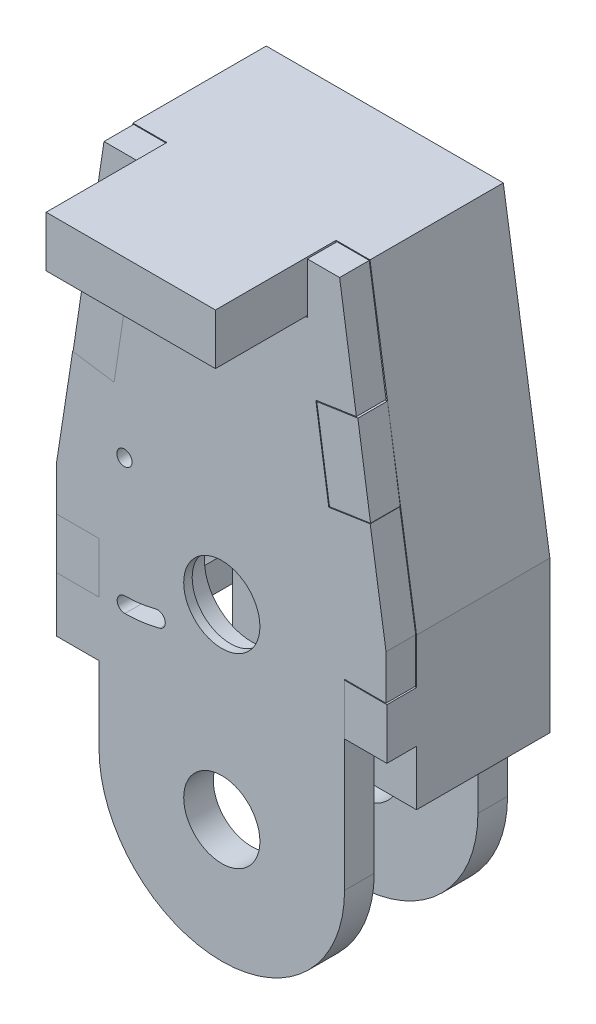
from build123d import *

# Parameters (mm, degrees)
SKETCH1_R           = 4
BOSS_EXTRUDE1_DEPTH = 30
SKETCH1_3_R         = 4
CUT_EXTRUDE1_DEPTH  = 17.5
BOSS_EXTRUDE2_DEPTH = 7
BOSS_EXTRUDE3_DEPTH = 31.5
CUT_EXTRUDE2_DEPTH  = 224.888365039
SKETCH5_R           = 9
CUT_EXTRUDE3_DEPTH  = 224.888365039
SKETCH5_3_R         = 11.1
SKETCH5_3_R_2       = 9
CUT_EXTRUDE4_DEPTH  = 5
SKETCH8_W           = 10
SKETCH8_H           = 12
BOSS_EXTRUDE4_DEPTH = 7
BOSS_EXTRUDE6_DEPTH = 7
SKETCH12_R          = 9
CUT_EXTRUDE5_DEPTH  = 220.79365323
CUT_EXTRUDE8_START  = -5
SKETCH12_6_R        = 11.1
SKETCH12_6_R_2      = 9
CUT_EXTRUDE8_DEPTH  = 5
SKETCH14_R          = 1.8
CUT_EXTRUDE9_DEPTH  = 7
CUT_EXTRUDE10_DEPTH = 24.5
SKETCH16_W          = 80
SKETCH16_H          = 75
CUT_EXTRUDE11_DEPTH = 162.669415784


# Read off the part's stored shape, not the designer's step: Boss-Extrude6
with BuildPart() as part:
    # Sketch1 → Boss-Extrude1 (new, symmetric)
    with BuildSketch(Plane.XY):
        with BuildLine():
            Line((-20, -72), (20, -72))
            Line((20, -72), (20, 0))
            ThreePointArc((20, 0), (18.973665961, 6.32455532), (16, 12))
            ThreePointArc((16, 12), (0, 16.622844919), (-16, 12))
            ThreePointArc((-16, 12), (-18.973665961, 6.32455532), (-20, 0))
            Line((-20, 0), (-20, -72))
        make_face()
        Circle(SKETCH1_R, mode=Mode.SUBTRACT)
    extrude(amount=BOSS_EXTRUDE1_DEPTH, both=True)

    # Sketch1<3> → Cut-Extrude1 (cut, symmetric)
    with BuildSketch(Plane.XY):
        with BuildLine():
            Line((-20, -60), (20, -60))
            Line((20, -60), (20, 0))
            ThreePointArc((20, 0), (18.973665961, 6.32455532), (16, 12))
            ThreePointArc((16, 12), (0, 16.622844919), (-16, 12))
            ThreePointArc((-16, 12), (-18.973665961, 6.32455532), (-20, 0))
            Line((-20, 0), (-20, -60))
        make_face()
        Circle(SKETCH1_3_R, mode=Mode.SUBTRACT)
    extrude(amount=CUT_EXTRUDE1_DEPTH, both=True, mode=Mode.SUBTRACT)

    # Sketch2 → Boss-Extrude2 (add)
    with BuildSketch(Plane(origin=(0, 0, -30), x_dir=(-1, 0, 0), z_dir=(0, 0, -1))):
        with BuildLine():
            Line((-20, -72), (-29, -132))
            Line((-29, -132), (-29, -167))
            Line((-29, -167), (-29, -185))
            ThreePointArc((-29, -185), (0, -214), (29, -185))
            Line((29, -185), (29, -167))
            Line((29, -167), (29, -132))
            Line((29, -132), (20, -72))
            Line((20, -72), (-20, -72))
        make_face()
    extrude(amount=-BOSS_EXTRUDE2_DEPTH)

    # Sketch2<3> → Boss-Extrude3 (add)
    with BuildSketch(Plane(origin=(0, 0, -30), x_dir=(-1, 0, 0), z_dir=(0, 0, -1))):
        Polygon((-29, -167), (-29, -132), (-20, -72), (-20, -60), (-28, -60), (-39, -131.254171946), (-39, -167), align=None)
        Polygon((20, -60), (20, -72), (29, -132), (29, -167), (39, -167), (39, -131.254171946), (28, -60), align=None)
    extrude(amount=-BOSS_EXTRUDE3_DEPTH)

    # Sketch4 → Cut-Extrude2 (cut, through all)
    with BuildSketch(Plane.XY.offset(-23)):
        with BuildLine():
            Line((-13.7, -112), (-13.7, -105))
            ThreePointArc((-13.7, -105), (-15.5, -103.2), (-17.3, -105))
            Line((-17.3, -105), (-17.3, -112))
            ThreePointArc((-17.3, -112), (-15.5, -113.8), (-13.7, -112))
        make_face()
        with BuildLine():
            Line((17.3, -112), (17.3, -105))
            ThreePointArc((17.3, -105), (15.5, -103.2), (13.7, -105))
            Line((13.7, -105), (13.7, -112))
            ThreePointArc((13.7, -112), (15.5, -113.8), (17.3, -112))
        make_face()
        with BuildLine():
            Line((17.3, -81), (17.3, -74))
            ThreePointArc((17.3, -74), (15.5, -72.2), (13.7, -74))
            Line((13.7, -74), (13.7, -81))
            ThreePointArc((13.7, -81), (15.5, -82.8), (17.3, -81))
        make_face()
        with BuildLine():
            Line((11.1, -96.5), (11.1, -89.5))
            ThreePointArc((11.1, -89.5), (0, -78.4), (-11.1, -89.5))
            Line((-11.1, -89.5), (-11.1, -96.5))
            ThreePointArc((-11.1, -96.5), (0, -107.6), (11.1, -96.5))
        make_face()
        with BuildLine():
            Line((-13.7, -81), (-13.7, -74))
            ThreePointArc((-13.7, -74), (-15.5, -72.2), (-17.3, -74))
            Line((-17.3, -74), (-17.3, -81))
            ThreePointArc((-17.3, -81), (-15.5, -82.8), (-13.7, -81))
        make_face()
    extrude(amount=-CUT_EXTRUDE2_DEPTH, mode=Mode.SUBTRACT)

    # Sketch5 → Cut-Extrude3 (cut, through all)
    with BuildSketch(Plane.XY.offset(-23)):
        with Locations((0, -185)):
            Circle(SKETCH5_R)
        with Locations((0, -141)):
            Circle(SKETCH5_R)
    extrude(amount=-CUT_EXTRUDE3_DEPTH, mode=Mode.SUBTRACT)

    # Sketch5<3> → Cut-Extrude4 (cut)
    # profile 1 of 2: a face of its own
    with BuildSketch(Plane.XY.offset(-23)):
        with Locations((0, -141)):
            Circle(SKETCH5_3_R)
        with Locations((0, -141)):
            Circle(SKETCH5_3_R_2, mode=Mode.SUBTRACT)
    # profile 2 of 2: a face of its own
    with BuildSketch(Plane.XY.offset(-23)):
        with Locations((0, -185)):
            Circle(SKETCH5_3_R)
        with Locations((0, -185)):
            Circle(SKETCH5_3_R_2, mode=Mode.SUBTRACT)
    extrude(amount=-CUT_EXTRUDE4_DEPTH, mode=Mode.SUBTRACT)

    # Sketch8 → Boss-Extrude4 (add)
    with BuildSketch(Plane.XY.offset(1.5)):
        Polygon((-22.43982913, -88.265527531), (-32.138947235, -86.810659815), (-35.138947235, -106.810659815), (-25.43982913, -108.265527531), align=None)
        with Locations((-34, -148)):
            Rectangle(SKETCH8_W, SKETCH8_H)
        with Locations((34, -148)):
            Rectangle(SKETCH8_W, SKETCH8_H)
        Polygon((25.43982913, -108.265527531), (22.43982913, -88.265527531), (32.138947235, -86.810659815), (35.138947235, -106.810659815), align=None)
    extrude(amount=BOSS_EXTRUDE4_DEPTH)

    # Sketch15 → Cut-Extrude10 (cut)
    with BuildSketch(Plane.XY.offset(-23)):
        with BuildLine():
            Line((-29, -145), (-29, -160))
            ThreePointArc((-29, -160), (-31.95326153, -152.5), (-29, -145))
        make_face()
    extrude(amount=CUT_EXTRUDE10_DEPTH, mode=Mode.SUBTRACT)

    # Sketch16 → Cut-Extrude11 (cut, through all)
    with BuildSketch(Plane(origin=(0, -60, 0), x_dir=(1, 0, 0), z_dir=(0, 1, 0))):
        Rectangle(SKETCH16_W, SKETCH16_H)
    extrude(amount=CUT_EXTRUDE11_DEPTH, mode=Mode.SUBTRACT)


with BuildPart() as body_2:
    # Boss-Extrude6 outline → Boss-Extrude6 (new body)
    with BuildSketch(Plane.XY.offset(1.5)):
        with BuildLine():
            ThreePointArc((-29, -185), (0, -214), (29, -185))
            Line((29, -185), (29, -141.8))
            Line((29, -141.8), (38.8, -141.8))
            Line((38.8, -141.8), (38.8, -131.26951874))
            Line((38.8, -131.26951874), (35.050902338, -106.984168789))
            Line((35.050902338, -106.984168789), (25.271837137, -108.493830809))
            Line((25.271837137, -108.493830809), (22.212373769, -88.097408351))
            Line((22.212373769, -88.097408351), (31.796725847, -86.659755539))
            Line((31.796725847, -86.659755539), (27.827762516, -60.2))
            Line((27.827762516, -60.2), (20.2, -60.2))
            Line((20.2, -60.2), (20.2, -72.2))
            Line((20.2, -72.2), (-20.2, -72.2))
            Line((-20.2, -72.2), (-20.2, -60.2))
            Line((-20.2, -60.2), (-27.827762516, -60.2))
            Line((-27.827762516, -60.2), (-31.796725847, -86.659755539))
            Line((-31.796725847, -86.659755539), (-22.410161039, -88.067740261))
            Line((-22.410161039, -88.067740261), (-25.43982913, -108.265527531))
            Line((-25.43982913, -108.265527531), (-35.218046965, -106.755996324))
            Line((-35.218046965, -106.755996324), (-39, -131.254171946))
            Line((-39, -131.254171946), (-39, -142))
            Line((-39, -142), (-29, -142))
            Line((-29, -142), (-29, -154))
            Line((-29, -154), (-39, -154))
            Line((-39, -154), (-39, -167))
            Line((-39, -167), (-29, -167))
            Line((-29, -167), (-29, -185))
        make_face()
    extrude(amount=BOSS_EXTRUDE6_DEPTH)

    # Sketch12 → Cut-Extrude5 (cut, through all)
    with BuildSketch(Plane(origin=(0, 0, 1.5), x_dir=(-1, 0, 0), z_dir=(0, 0, -1))):
        with Locations((0, -185)):
            Circle(SKETCH12_R)
        with Locations((0, -141)):
            Circle(SKETCH12_R)
    extrude(amount=-CUT_EXTRUDE5_DEPTH, mode=Mode.SUBTRACT)

    # Sketch12<6> → Cut-Extrude8 (cut)
    with BuildSketch(Plane(origin=(0, 0, 1.5), x_dir=(-1, 0, 0), z_dir=(0, 0, -1)).offset(CUT_EXTRUDE8_START)):
        with Locations((0, -141)):
            Circle(SKETCH12_6_R)
        with Locations((0, -141)):
            Circle(SKETCH12_6_R_2, mode=Mode.SUBTRACT)
    extrude(amount=CUT_EXTRUDE8_DEPTH, mode=Mode.SUBTRACT)

    # Sketch14 → Cut-Extrude9 (cut)
    with BuildSketch(Plane.XY.offset(8.5)):
        with BuildLine():
            ThreePointArc((-22.909945843, -154.299872488), (-18.76, -154.016065744), (-14.682601732, -153.193010378))
            ThreePointArc((-14.682601732, -153.193010378), (-13.416057651, -150.984874039), (-15.624193989, -149.718329958))
            ThreePointArc((-15.624193989, -149.718329958), (-19.24, -150.448209245), (-22.920140653, -150.699886923))
            ThreePointArc((-22.920140653, -150.699886923), (-24.715036031, -152.504977111), (-22.909945843, -154.299872488))
        make_face()
        with Locations((-23, -122.5)):
            Circle(SKETCH14_R)
    extrude(amount=-CUT_EXTRUDE9_DEPTH, mode=Mode.SUBTRACT)


solid = Compound([part.part, body_2.part])
